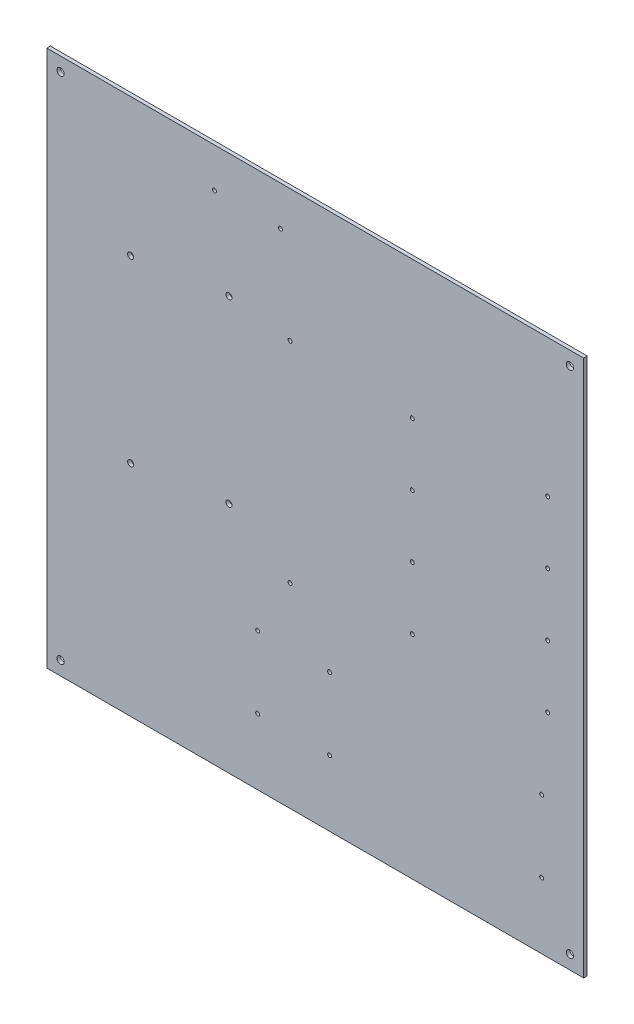
from build123d import *

# Parameters (mm, degrees)
SCHIZZO1_W                   = 448
SCHIZZO1_H                   = 448
SCHIZZO1_R                   = 3
SCHIZZO1_R_2                 = 1.65
SCHIZZO1_R_3                 = 2.5
ESTRUSIONE_ESTRUSIONE1_DEPTH = 3


with BuildPart() as part:
    # Schizzo1 → Estrusione-Estrusione1 (new body)
    with BuildSketch(Plane.XY):
        with Locations((224, 224)):
            Rectangle(SCHIZZO1_W, SCHIZZO1_H)
        with Locations((11.5, 436.5)):
            Circle(SCHIZZO1_R, mode=Mode.SUBTRACT)
        with Locations((436.5, 436.5)):
            Circle(SCHIZZO1_R, mode=Mode.SUBTRACT)
        with Locations((11.5, 11.5)):
            Circle(SCHIZZO1_R, mode=Mode.SUBTRACT)
        with Locations((436.5, 11.5)):
            Circle(SCHIZZO1_R, mode=Mode.SUBTRACT)
        with Locations((418, 177)):
            Circle(SCHIZZO1_R_2, mode=Mode.SUBTRACT)
        with Locations((305, 177)):
            Circle(SCHIZZO1_R_2, mode=Mode.SUBTRACT)
        with Locations((418, 229)):
            Circle(SCHIZZO1_R_2, mode=Mode.SUBTRACT)
        with Locations((305, 229)):
            Circle(SCHIZZO1_R_2, mode=Mode.SUBTRACT)
        with Locations((418, 281)):
            Circle(SCHIZZO1_R_2, mode=Mode.SUBTRACT)
        with Locations((305, 281)):
            Circle(SCHIZZO1_R_2, mode=Mode.SUBTRACT)
        with Locations((418, 333)):
            Circle(SCHIZZO1_R_2, mode=Mode.SUBTRACT)
        with Locations((305, 333)):
            Circle(SCHIZZO1_R_2, mode=Mode.SUBTRACT)
        with Locations((140, 415)):
            Circle(SCHIZZO1_R_2, mode=Mode.SUBTRACT)
        with Locations((195, 415)):
            Circle(SCHIZZO1_R_2, mode=Mode.SUBTRACT)
        with Locations((70, 333)):
            Circle(SCHIZZO1_R_3, mode=Mode.SUBTRACT)
        with Locations((70, 183)):
            Circle(SCHIZZO1_R_3, mode=Mode.SUBTRACT)
        with Locations((236, 55)):
            Circle(SCHIZZO1_R_2, mode=Mode.SUBTRACT)
        with Locations((236, 115)):
            Circle(SCHIZZO1_R_2, mode=Mode.SUBTRACT)
        with Locations((413, 115)):
            Circle(SCHIZZO1_R_2, mode=Mode.SUBTRACT)
        with Locations((413, 55)):
            Circle(SCHIZZO1_R_2, mode=Mode.SUBTRACT)
        with Locations((152, 344.76958941)):
            Circle(SCHIZZO1_R_3, mode=Mode.SUBTRACT)
        with Locations((152, 194.76958941)):
            Circle(SCHIZZO1_R_3, mode=Mode.SUBTRACT)
        with Locations((203, 338)):
            Circle(SCHIZZO1_R_2, mode=Mode.SUBTRACT)
        with Locations((203, 163)):
            Circle(SCHIZZO1_R_2, mode=Mode.SUBTRACT)
        with Locations((176, 115)):
            Circle(SCHIZZO1_R_2, mode=Mode.SUBTRACT)
        with Locations((176, 55)):
            Circle(SCHIZZO1_R_2, mode=Mode.SUBTRACT)
    extrude(amount=-ESTRUSIONE_ESTRUSIONE1_DEPTH)


solid = part.part
